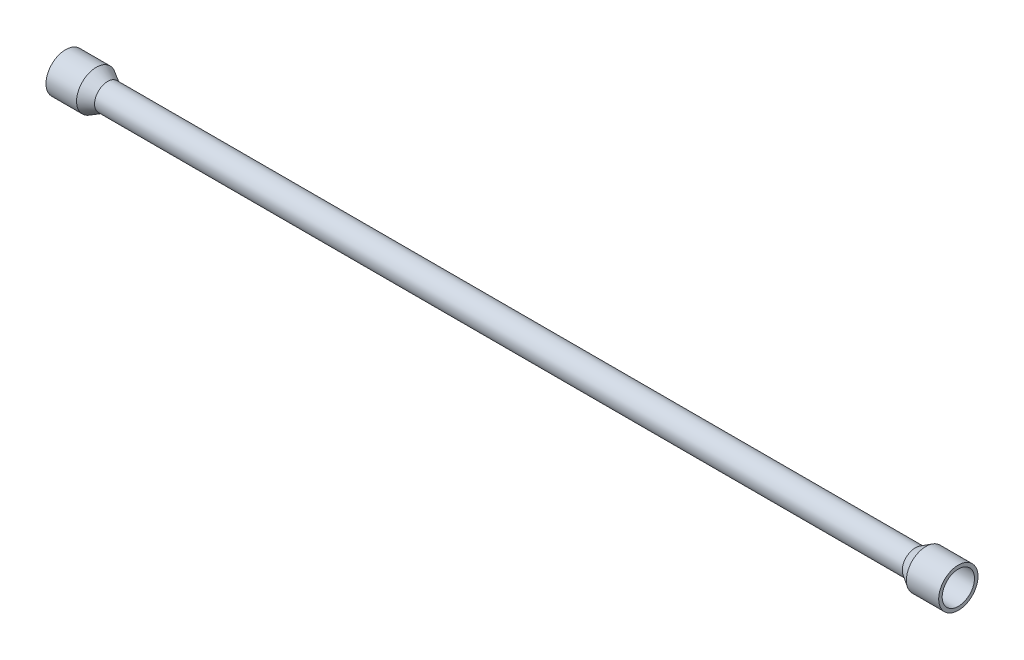
from build123d import *

# Parameters (mm, degrees)
SKETCH1_R           = 75
SKETCH1_R_2         = 37.5
BOSS_EXTRUDE1_DEPTH = 4750
SKETCH2_R           = 112.5
SKETCH2_R_2         = 92.5
BOSS_EXTRUDE2_DEPTH = 185
SKETCH6_R           = 112.5
SKETCH6_R_2         = 87.5
BOSS_EXTRUDE3_DEPTH = 175


with BuildPart() as part:
    # Sketch1 → Boss-Extrude1 (new body)
    with BuildSketch(Plane(origin=(0, 0, 0), x_dir=(0, 0, -1), z_dir=(1, 0, 0))):
        Circle(SKETCH1_R)
        Circle(SKETCH1_R_2, mode=Mode.SUBTRACT)
    extrude(amount=BOSS_EXTRUDE1_DEPTH)



with BuildPart() as body_2:
    # Sketch2 → Boss-Extrude2 (new body)
    with BuildSketch(Plane(origin=(4750, 0, 0), x_dir=(0, 0, -1), z_dir=(1, 0, 0))):
        Circle(SKETCH2_R)
        Circle(SKETCH2_R_2, mode=Mode.SUBTRACT)
    extrude(amount=BOSS_EXTRUDE2_DEPTH)


with BuildPart() as part_1:
    add(part.part)

    add(body_2.part)  # Revolve1 merges body 2
    # Sketch4 → Revolve1 (revolve)
    with BuildSketch(Plane.XY):
        Polygon((4750, 112.5), (4688.834916054, 75), (4750, 75), align=None)
    revolve(axis=Axis((5128.632077333, 0, 0), (-1, 0, 0)))



with BuildPart() as body_2_2:
    # Sketch6 → Boss-Extrude3 (new body)
    with BuildSketch(Plane.ZY):
        Circle(SKETCH6_R)
        Circle(SKETCH6_R_2, mode=Mode.SUBTRACT)
    extrude(amount=BOSS_EXTRUDE3_DEPTH)


with BuildPart() as part_2:
    add(part_1.part)

    add(body_2_2.part)  # Revolve2 merges body 2 2
    # Sketch7 → Revolve2 (revolve)
    with BuildSketch(Plane.XY):
        Polygon((0, 112.5), (65.363242372, 75), (0, 75), align=None)
    revolve(axis=Axis((0, 0, 0), (-1, 0, 0)))


solid = part_2.part
